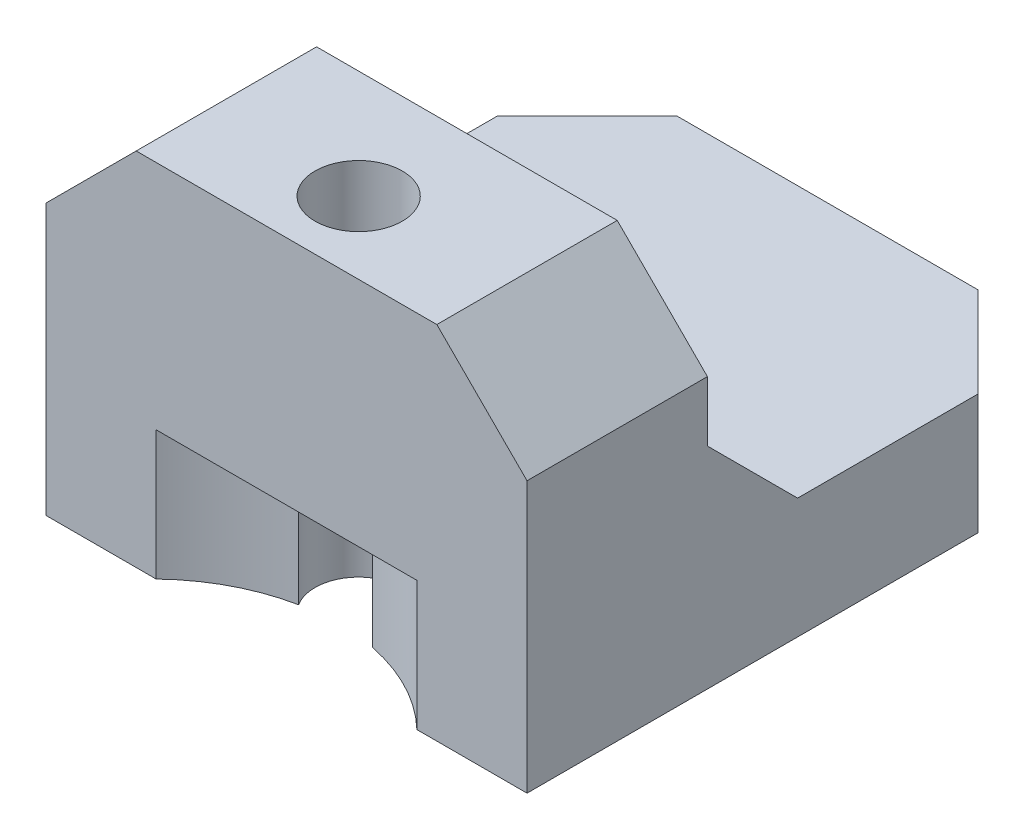
from build123d import *

# Parameters (mm, degrees)
SKETCH_1_W          = 16
SKETCH_1_H          = 18
EXTRUDE_1_DEPTH     = 4
SKETCH_2_R          = 1.65
CUT_EXTRUDE_1_DEPTH = 4
SKETCH_3_W          = 16
SKETCH_3_H          = 6
EXTRUDE_2_DEPTH     = 8
SKETCH_4_R          = 1.45
CUT_EXTRUDE_2_DEPTH = 27.907248094
CHAMFER_1_SIZE      = 3
CHAMFER_2_SIZE      = 3
CHAMFER_3_SIZE      = 3
SKETCH_6_R          = 3
CUT_EXTRUDE_3_DEPTH = 26.377155081
SKETCH_7_R          = 6.25
CUT_EXTRUDE_4_DEPTH = 2.8
CHAMFER_4_SIZE      = 1.5


with BuildPart() as part:
    # 草图1 → 凸台-拉伸1 (new body)
    with BuildSketch(Plane(origin=(0, 0, 0), x_dir=(1, 0, 0), z_dir=(0, 1, 0))):
        with Locations((8, 9)):
            Rectangle(SKETCH_1_W, SKETCH_1_H)
    extrude(amount=EXTRUDE_1_DEPTH)

    # 草图2 → 切除-拉伸1 (cut)
    with BuildSketch(Plane(origin=(0, 4, 0), x_dir=(1, 0, 0), z_dir=(0, 1, 0))):
        with Locations(Location((8, 10, 0), (0, 0, 270))):
            Circle(SKETCH_2_R)
    extrude(amount=-CUT_EXTRUDE_1_DEPTH, mode=Mode.SUBTRACT)

    # 草图3 → 凸台-拉伸2 (add)
    with BuildSketch(Plane(origin=(0, 4, 0), x_dir=(1, 0, 0), z_dir=(0, 1, 0))):
        with Locations((8, 3)):
            Rectangle(SKETCH_3_W, SKETCH_3_H)
    extrude(amount=EXTRUDE_2_DEPTH)

    # 草图4 → 切除-拉伸2 (cut, through all)
    with BuildSketch(Plane(origin=(0, 12, 0), x_dir=(1, 0, 0), z_dir=(0, 1, 0))):
        with Locations(Location((8, 2.4, 0), (0, 0, 270))):
            Circle(SKETCH_4_R)
    extrude(amount=-CUT_EXTRUDE_2_DEPTH, mode=Mode.SUBTRACT)

    # 倒角1
    chamfer_1_edges = [part.edges().sort_by_distance(p)[0] for p in [
        (0, 2, -18),
        (16, 2, -18),
    ]]
    chamfer(chamfer_1_edges, length=CHAMFER_1_SIZE)

    # 倒角2
    # the kernel refuses this chamfer: 3 mm, written as the material it adds along each edge
    with BuildSketch(Plane(origin=(16, 4, -6), x_dir=(0, -0.02749587661058635, -0.9996219169112968), z_dir=(-1, 0, 0))) as chamfer_2_piece_1_section:
        Polygon((CHAMFER_2_SIZE * 0.999621916911, -CHAMFER_2_SIZE * 0.0274958766106), (-CHAMFER_2_SIZE * 0.0274958766106, -CHAMFER_2_SIZE * 0.999621916911), (0, 0), align=None)
    chamfer_2_piece_1 = extrude(amount=16, mode=Mode.PRIVATE)
    chamfer_2_piece_1 = chamfer_2_piece_1 - Plane(origin=(8, 4.994786575, -10), x_dir=(0, 0, 1), z_dir=(0, 1, 0)) * Cylinder(1.65, 44, mode=Mode.PRIVATE)
    add(chamfer_2_piece_1)

    # 倒角3
    chamfer_3_edges = [part.edges().sort_by_distance(p)[0] for p in [
        (0, 12, -3),
        (16, 12, -3),
    ]]
    chamfer(chamfer_3_edges, length=CHAMFER_3_SIZE)

    # 草图6 → 切除-拉伸3 (cut, through all)
    with BuildSketch(Plane(origin=(0, 4, 0), x_dir=(1, 0, 0), z_dir=(0, 1, 0))):
        with Locations((8, 10)):
            Circle(SKETCH_6_R)
    extrude(amount=CUT_EXTRUDE_3_DEPTH, mode=Mode.SUBTRACT)

    # 草图7 → 切除-拉伸4 (cut)
    with BuildSketch(Plane(origin=(0, 0, 0), x_dir=(-1, 0, 0), z_dir=(0, -1, 0))):
        with Locations((-8, -4.5)):
            Circle(SKETCH_7_R)
    extrude(amount=-CUT_EXTRUDE_4_DEPTH, mode=Mode.SUBTRACT)

    # 倒角4
    # the kernel refuses this chamfer: 1.5 mm, written as the material it takes off along each edge
    with BuildSketch(Plane(origin=(16.194862375, 2.8, 0), x_dir=(0, 0.9996219169112969, 0.027495876610586382), z_dir=(-1, 0, 0))) as chamfer_4_piece_1_section:
        Polygon((CHAMFER_4_SIZE * 0.999621916911, CHAMFER_4_SIZE * 0.0274958766106), (-CHAMFER_4_SIZE * 0.0274958766106, CHAMFER_4_SIZE * 0.999621916911), (0, 0), align=None)
    chamfer_4_piece_1 = extrude(amount=16.38972475, mode=Mode.PRIVATE)
    chamfer_4_piece_1 = chamfer_4_piece_1 & Plane(origin=(8, 3.325118299, 4.5), x_dir=(-1, 0, 0), z_dir=(0, -1, 0)) * Cylinder(6.25, 39, mode=Mode.PRIVATE)
    add(chamfer_4_piece_1, mode=Mode.SUBTRACT)


solid = part.part
